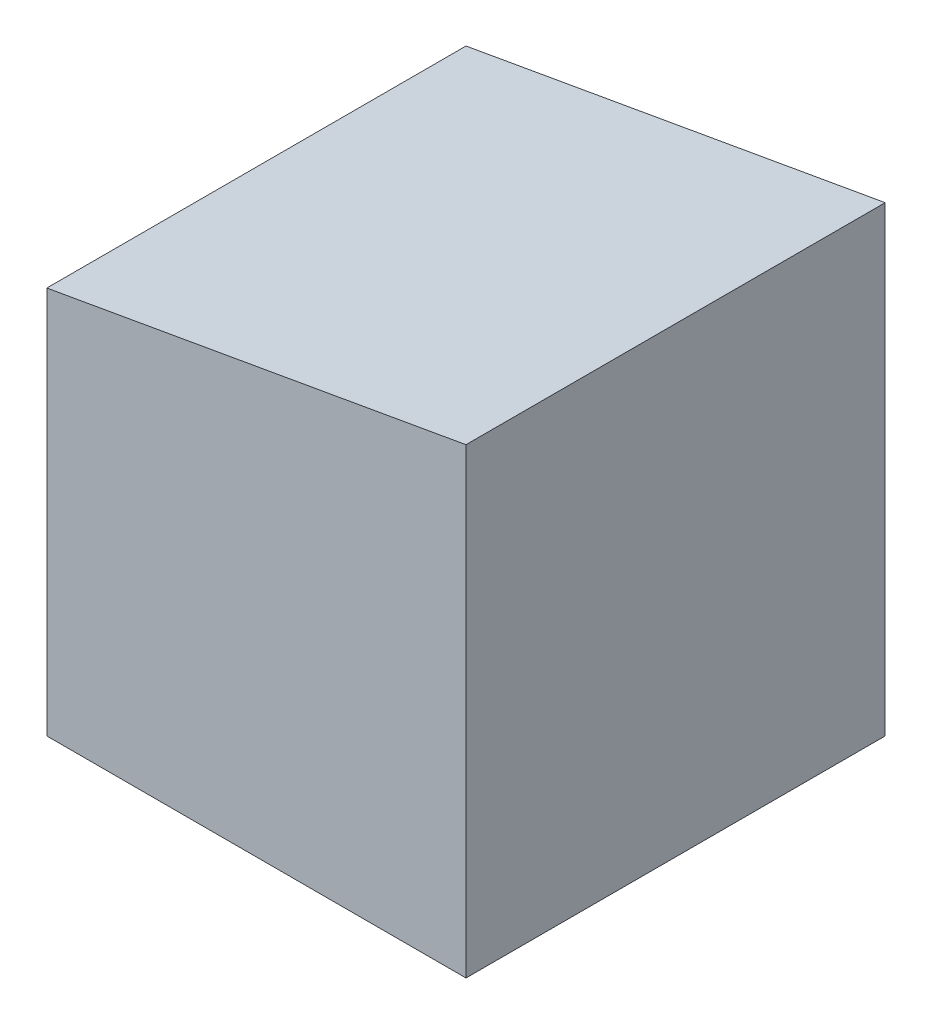
from build123d import *

# Parameters (mm, degrees)
SKETCH1_W           = 88.9
SKETCH1_H           = 88.9
BOSS_EXTRUDE1_DEPTH = 97.95
CUT_EXTRUDE1_DEPTH  = 135


with BuildPart() as part:
    # Sketch1 → Boss-Extrude1 (new body)
    with BuildSketch(Plane(origin=(0, 0, 0), x_dir=(1, 0, 0), z_dir=(0, 1, 0))):
        Rectangle(SKETCH1_W, SKETCH1_H)
    extrude(amount=BOSS_EXTRUDE1_DEPTH)

    # Sketch2 → Cut-Extrude1 (cut)
    with BuildSketch(Plane.XY.offset(44.45)):
        Polygon((44.45, 97.95), (-44.45, 82.274531415), (-44.45, 97.95), align=None)
    extrude(amount=-CUT_EXTRUDE1_DEPTH, mode=Mode.SUBTRACT)


solid = part.part
